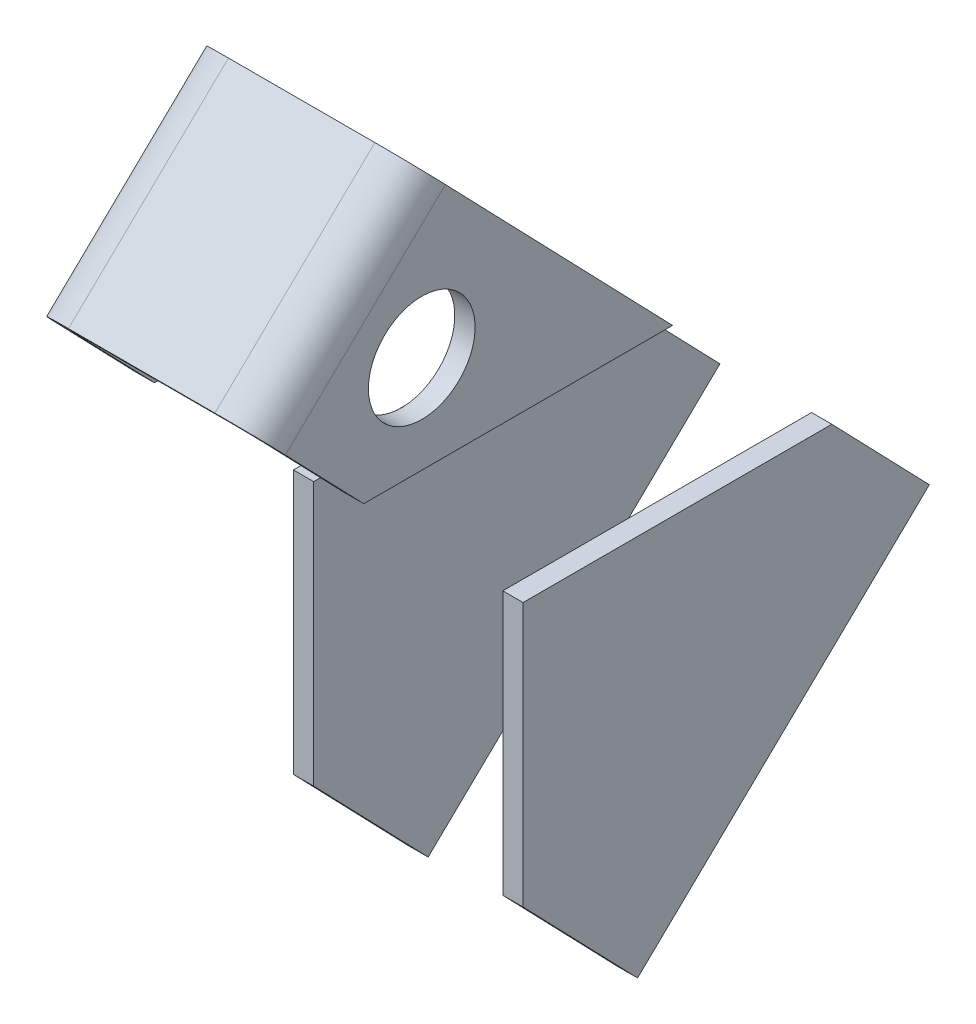
from build123d import *

# Parameters (mm, degrees)
BASE_FLANGE1_DEPTH      = 19.05
CUT_EXTRUDE1_START      = -21.59
CUT_EXTRUDE1_DEPTH      = 21.59
CUT_EXTRUDE2_DEPTH      = 87.128405868
CUT_EXTRUDE2_DEPTH_BACK = 87.128405868
CUT_EXTRUDE3_DEPTH      = 86.670726753
CUT_EXTRUDE3_DEPTH_BACK = 86.670726753
SKETCH9_R               = 5.0165
CUT_EXTRUDE6_DEPTH      = 86.058030225
CUT_EXTRUDE6_DEPTH_BACK = 86.058030225
SKETCH10_W              = 21.59
SKETCH10_H              = 15.531347002


# Read off the part's stored shape, not the designer's step: Cut-Extrude1
# Sheet-metal steps are written as plain solids
with BuildPart() as part:
    # Sketch1 → Base-Flange1 (new, symmetric)
    with BuildSketch(Plane(origin=(0, -0.842343472, 1.363693041), x_dir=(1, 0, 0), z_dir=(0, -0.6940771264425077, 0.7199006476933545))):
        with BuildLine():
            Line((-10.795, -64.676760458), (-10.795, 0.868157815))
            ThreePointArc((-10.795, 0.868157815), (-9.649318885, 3.6340767), (-6.8834, 4.779757815))
            Line((-6.8834, 4.779757815), (6.8834, 4.779757815))
            ThreePointArc((6.8834, 4.779757815), (9.649318885, 3.6340767), (10.795, 0.868157815))
            Line((10.795, 0.868157815), (10.795, -64.676760458))
            Line((10.795, -64.676760458), (8.89, -64.676760458))
            Line((8.89, -64.676760458), (8.89, 0.868157815))
            ThreePointArc((8.89, 0.868157815), (8.302280467, 2.287038282), (6.8834, 2.874757815))
            Line((6.8834, 2.874757815), (-6.8834, 2.874757815))
            ThreePointArc((-6.8834, 2.874757815), (-8.302280467, 2.287038282), (-8.89, 0.868157815))
            Line((-8.89, 0.868157815), (-8.89, -64.676760458))
            Line((-8.89, -64.676760458), (-10.795, -64.676760458))
        make_face()
    extrude(amount=BASE_FLANGE1_DEPTH, both=True)

    # Cut-Extrude1 outline → Cut-Extrude1 (cut)
    with BuildSketch(Plane.ZY.offset(10.795).offset(CUT_EXTRUDE1_START)):
        Polygon((3.295278576, -1.498700046), (-19.05, -24.675347002), (-19.05, -49.462056695), (15.680368861, -13.439525358), (18.395320949, -10.623561984), (6.010230664, 1.317263328), align=None)
    extrude(amount=CUT_EXTRUDE1_DEPTH, mode=Mode.SUBTRACT)

    # Sketch7 → Cut-Extrude2 (cut, two sides: drawn at the far end of the back side and taken through both)
    with BuildSketch(Plane.ZY.offset(10.795).offset(-CUT_EXTRUDE2_DEPTH_BACK)):
        Polygon((11.882741933, -6.055059051), (9.429090908, -1.978959147), (12.655449119, -0.036819034), (15.109100144, -4.112918938), align=None)
    extrude(amount=CUT_EXTRUDE2_DEPTH + CUT_EXTRUDE2_DEPTH_BACK, mode=Mode.SUBTRACT)

    # Sketch9 → Cut-Extrude3 (cut, two sides: drawn at the far end of the back side and taken through both)
    with BuildSketch(Plane.ZY.offset(-8.89).offset(-CUT_EXTRUDE3_DEPTH_BACK)):
        with Locations((-9.525, 0)):
            Circle(SKETCH9_R)
    extrude(amount=CUT_EXTRUDE3_DEPTH + CUT_EXTRUDE3_DEPTH_BACK, mode=Mode.SUBTRACT)

    # Sketch10 → Cut-Extrude6 (cut, two sides: drawn at the far end of the back side and taken through both)
    with BuildSketch(Plane.XY.offset(1.435180439).offset(-CUT_EXTRUDE6_DEPTH_BACK)):
        with Locations((0, -16.909673501)):
            Rectangle(SKETCH10_W, SKETCH10_H)
    extrude(amount=CUT_EXTRUDE6_DEPTH + CUT_EXTRUDE6_DEPTH_BACK, mode=Mode.SUBTRACT)


with BuildPart() as cut_extrude6_piece_1:
    # of the separate pieces the step leaves, piece 1, a body of its own (cut_extrude6_pieces)
    add(part.part.solids().sort_by_distance((-10.795, -9.144, -33.102159972))[0])


with BuildPart() as cut_extrude6_piece_2:
    # of the separate pieces the step leaves, piece 2, a body of its own (cut_extrude6_pieces)
    add(part.part.solids().sort_by_distance((-10.795, -34.181015958, -57.241074344))[0])


with BuildPart() as cut_extrude6_piece_3:
    # of the separate pieces the step leaves, piece 3, a body of its own (cut_extrude6_pieces)
    add(part.part.solids().sort_by_distance((10.795, -24.675347002, -48.076382778))[0])


solid = Compound([cut_extrude6_piece_1.part, cut_extrude6_piece_2.part, cut_extrude6_piece_3.part])
